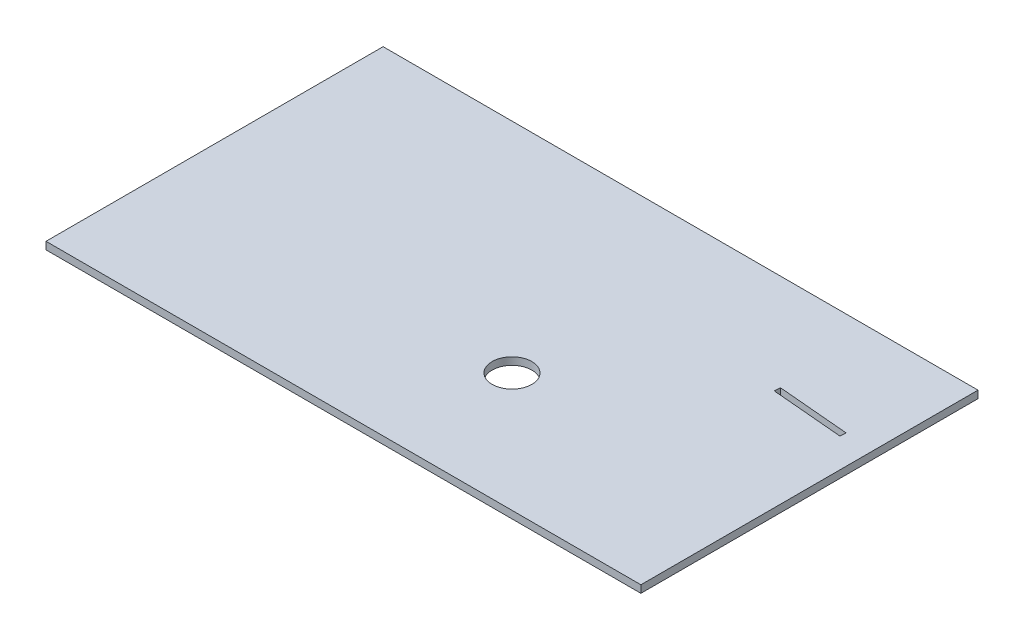
from build123d import *

# Parameters (mm, degrees)
BOSS_EXTRUDE1_DEPTH    = 50.8
SKETCH4_W              = 1524
SKETCH4_H              = 863.6
BOSS_EXTRUDE2_DEPTH    = 19.05
F_20_0MM_DOWEL_HOLE1_D = 101.6
SKETCH8_W              = 1.5875
SKETCH8_H              = 50.8
BOSS_EXTRUDE3_DEPTH    = 204
CUT_EXTRUDE1_DEPTH     = 1052.265465998


with BuildPart() as part:
    # Sketch3 → Boss-Extrude1 (new body)
    with BuildSketch(Plane(origin=(0, 0, 0), x_dir=(1, 0, 0), z_dir=(0, 1, 0))):
        with BuildLine():
            Line((-524, 0), (-525.5875, 0))
            ThreePointArc((-525.5875, 0), (-255.243310314, 459.448661655), (277.677694458, 446.248045549))
            Line((277.677694458, 446.248045549), (277.677694458, 444.377202386))
            ThreePointArc((277.677694458, 444.377202386), (-254.040241009, 458.300726541), (-524, 0))
        make_face()
    extrude(amount=BOSS_EXTRUDE1_DEPTH)

    # Sketch4 → Boss-Extrude2 (add)
    with BuildSketch(Plane(origin=(0, 50.8, 0), x_dir=(1, 0, 0), z_dir=(0, 1, 0))):
        with Locations((-127, 127)):
            Rectangle(SKETCH4_W, SKETCH4_H)
    extrude(amount=BOSS_EXTRUDE2_DEPTH)

    # Ø20.0mm Dowel Hole1 (through all)
    with Locations(Plane(origin=(0, 50.8, 0), x_dir=(-1, 0, 0), z_dir=(0, -1, 0))):
        with Locations((0, 0)):
            Hole(F_20_0MM_DOWEL_HOLE1_D / 2)

    # Sketch8 → Boss-Extrude3 (add)
    with BuildSketch(Plane.XY):
        with Locations((-524.79375, 25.4)):
            Rectangle(SKETCH8_W, SKETCH8_H)
    extrude(amount=BOSS_EXTRUDE3_DEPTH)

    # Sketch9 → Cut-Extrude1 (cut, through all)
    with BuildSketch(Plane(origin=(0, 50.8, 0), x_dir=(-1, 0, 0), z_dir=(0, -1, 0))):
        Polygon((-377.011316994, 311.06673288), (-561.307336141, 294.942920471), (-560, 280), (-375.703980853, 296.123812408), align=None)
    extrude(amount=-CUT_EXTRUDE1_DEPTH, mode=Mode.SUBTRACT)


solid = part.part
